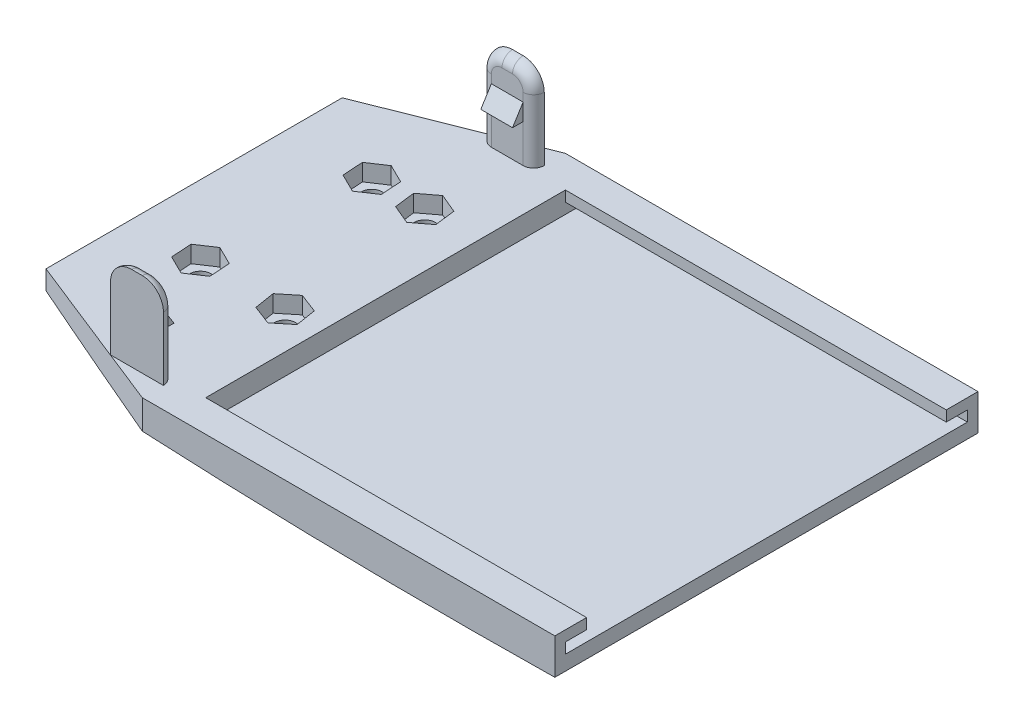
from build123d import *

# Parameters (mm, degrees)
SKETCH1_W                = 270.5
SKETCH1_H                = 200
MAINBODY_DEPTH           = 9
MAINBODYCURVE_DEPTH      = 100
MAINBODYCURVE_DEPTH_BACK = 100
BOLTHOLE_DEPTH           = 170.097967804
BOLTHOLE_DEPTH_BACK      = 170.097967804
SKETCH5_R                = 5
BOLTHEXHOLE_DEPTH        = 8
SLIDECUT_DEPTH           = 180
SKETCH18_W               = 25
SKETCH18_H               = 5
TABS_DEPTH               = 40
SKETCH19_W               = 15
SKETCH19_H               = 8
TABTRIANGLE1_DEPTH       = 5
TABTRIANGLECUT1_REACH    = 244.128
FILLET1_R                = 10
FILLET2_R                = 5
SKETCH21_W               = 15
SKETCH21_H               = 8
TABTRIANGLE2_DEPTH       = 5
TABTRIANGLECUT2_REACH    = 244.128
FILLET3_R                = 10
FILLET4_R                = 5
CUT_EXTRUDE15_DEPTH      = 173.89465737


with BuildPart() as part:
    # Sketch1 → MainBody (new body)
    with BuildSketch(Plane(origin=(0, 0, 0), x_dir=(1, 0, 0), z_dir=(0, 1, 0))):
        Rectangle(SKETCH1_W, SKETCH1_H)
    extrude(amount=MAINBODY_DEPTH)

    # Sketch12 → MainBodyCurve (add, two sides: drawn at the far end of the back side and taken through both)
    with BuildSketch(Plane.XY.offset(-MAINBODYCURVE_DEPTH_BACK)):
        with BuildLine():
            Line((135.25, 0), (135.25, -7.976686934))
            ThreePointArc((135.25, -7.976686934), (-0.091109356, -7.0779822), (-135.25, 0))
            Line((-135.25, 0), (135.25, 0))
        make_face()
    extrude(amount=MAINBODYCURVE_DEPTH + MAINBODYCURVE_DEPTH_BACK)

    # Sketch5 → BoltHole (cut, two sides: drawn at the far end of the back side and taken through both)
    with BuildSketch(Plane(origin=(0, 9, 0), x_dir=(1, 0, 0), z_dir=(0, 1, 0)).offset(-BOLTHOLE_DEPTH_BACK)):
        with Locations(Location((-102.25, -30, 0), (0, 0, 270))):
            Circle(SKETCH5_R)
        with Locations(Location((-95.25, 44, 0), (0, 0, 270))):
            Circle(SKETCH5_R)
        with Locations(Location((-70.25, 44, 0), (0, 0, 270))):
            Circle(SKETCH5_R)
        with Locations(Location((-62.25, -30, 0), (0, 0, 270))):
            Circle(SKETCH5_R)
    extrude(amount=BOLTHOLE_DEPTH + BOLTHOLE_DEPTH_BACK, mode=Mode.SUBTRACT)

    # Sketch13 → BoltHexHole (cut)
    with BuildSketch(Plane(origin=(0, 9, 0), x_dir=(1, 0, 0), z_dir=(0, 1, 0))):
        Polygon((-87.083976342, 49.445125431), (-95.882605121, 53.794546651), (-104.048628779, 48.34942122), (-103.416023658, 38.554874569), (-94.617394879, 34.205453349), (-86.451371221, 39.65057878), align=None)
        Polygon((-62.430442888, 49.931935595), (-71.477428362, 53.737902903), (-79.296985475, 47.805967308), (-78.069557112, 38.068064405), (-69.022571638, 34.262097097), (-61.203014525, 40.194032692), align=None)
        Polygon((-94.083976342, -24.554874569), (-102.882605121, -20.205453349), (-111.048628779, -25.65057878), (-110.416023658, -35.445125431), (-101.617394879, -39.794546651), (-93.451371221, -34.34942122), align=None)
        Polygon((-54.630390383, -23.813330248), (-63.798008362, -20.307889629), (-71.417617978, -26.494559381), (-69.869609617, -36.186669752), (-60.701991638, -39.692110371), (-53.082382022, -33.505440619), align=None)
    extrude(amount=-BOLTHEXHOLE_DEPTH, mode=Mode.SUBTRACT)

    # Sketch15 → SlideCut (cut)
    with BuildSketch(Plane(origin=(135.25, 0, 0), x_dir=(0, 0, -1), z_dir=(1, 0, 0))):
        Polygon((-85, 14), (85, 14), (85, 4), (95, 4), (95, -1), (-95, -1), (-95, 4), (-85, 4), align=None)
    extrude(amount=-SLIDECUT_DEPTH, mode=Mode.SUBTRACT)

    # Sketch18 → Tabs (add)
    with BuildSketch(Plane(origin=(0, 9, 0), x_dir=(1, 0, 0), z_dir=(0, 1, 0))):
        with Locations((-72.25, -87.5)):
            Rectangle(SKETCH18_W, SKETCH18_H)
        with Locations((-72.25, 87.5)):
            Rectangle(SKETCH18_W, SKETCH18_H)
    extrude(amount=TABS_DEPTH)

    # Sketch19 → TabTriangle1 (add)
    with BuildSketch(Plane(origin=(0, 0, 85), x_dir=(-1, 0, 0), z_dir=(0, 0, -1))):
        with Locations((72.25, 31)):
            Rectangle(SKETCH19_W, SKETCH19_H)
    extrude(amount=TABTRIANGLE1_DEPTH)

    # Sketch20 → TabTriangleCut1 (cut, up to next)
    with BuildSketch(Plane.ZY.offset(79.75), mode=Mode.PRIVATE) as tabtrianglecut1_sk1:
        Polygon((85, 35), (80, 27), (80, 35), align=None)
    tabtrianglecut1_tool1 = extrude(tabtrianglecut1_sk1.sketch, amount=-TABTRIANGLECUT1_REACH, mode=Mode.PRIVATE) & part.part
    add(tabtrianglecut1_tool1.solids().sort_by_distance((-79.75, 32.333333, 81.666667))[0], mode=Mode.SUBTRACT)

    # Fillet1
    fillet1_edges = [part.edges().sort_by_distance(p)[0] for p in [
        (-84.75, 49, 87.5),
        (-59.75, 49, 87.5),
    ]]
    fillet(fillet1_edges, radius=FILLET1_R)

    # Fillet2
    fillet2_edges = [part.edges().sort_by_distance(p)[0] for p in [
        (-84.75, 24, 85),
        (-59.75, 24, 85),
        (-62.678932188, 46.071067812, 85),
        (-72.25, 49, 85),
        (-81.821067812, 46.071067812, 85),
    ]]
    fillet(fillet2_edges, radius=FILLET2_R - 0.0001)  # a hair under: the kernel refuses the full size

    # Sketch21 → TabTriangle2 (add)
    with BuildSketch(Plane.XY.offset(-85)):
        with Locations((-72.25, 31)):
            Rectangle(SKETCH21_W, SKETCH21_H)
    extrude(amount=TABTRIANGLE2_DEPTH)

    # Sketch22 → TabTriangleCut2 (cut, up to next)
    with BuildSketch(Plane.ZY.offset(79.75), mode=Mode.PRIVATE) as tabtrianglecut2_sk1:
        Polygon((-80, 27), (-85, 35), (-80, 35), align=None)
    tabtrianglecut2_tool1 = extrude(tabtrianglecut2_sk1.sketch, amount=-TABTRIANGLECUT2_REACH, mode=Mode.PRIVATE) & part.part
    add(tabtrianglecut2_tool1.solids().sort_by_distance((-79.75, 32.333333, -81.666667))[0], mode=Mode.SUBTRACT)

    # Fillet3
    fillet3_edges = [part.edges().sort_by_distance(p)[0] for p in [
        (-84.75, 49, -87.5),
        (-59.75, 49, -87.5),
    ]]
    fillet(fillet3_edges, radius=FILLET3_R)

    # Fillet4
    fillet4_edges = [part.edges().sort_by_distance(p)[0] for p in [
        (-59.75, 24, -85),
        (-62.678932188, 46.071067812, -85),
        (-72.25, 49, -85),
        (-84.75, 24, -85),
        (-81.821067812, 46.071067812, -85),
    ]]
    fillet(fillet4_edges, radius=FILLET4_R - 0.0001)  # a hair under: the kernel refuses the full size

    # Sketch27 → Cut-Extrude15 (cut, through all)
    with BuildSketch(Plane(origin=(0, 9, 0), x_dir=(1, 0, 0), z_dir=(0, 1, 0))):
        Polygon((-59.75, 100), (-135.25, 70), (-135.25, 100), align=None)
        Polygon((-59.75, -100), (-135.25, -70), (-135.25, -100), align=None)
    extrude(amount=-CUT_EXTRUDE15_DEPTH, mode=Mode.SUBTRACT)


solid = part.part
